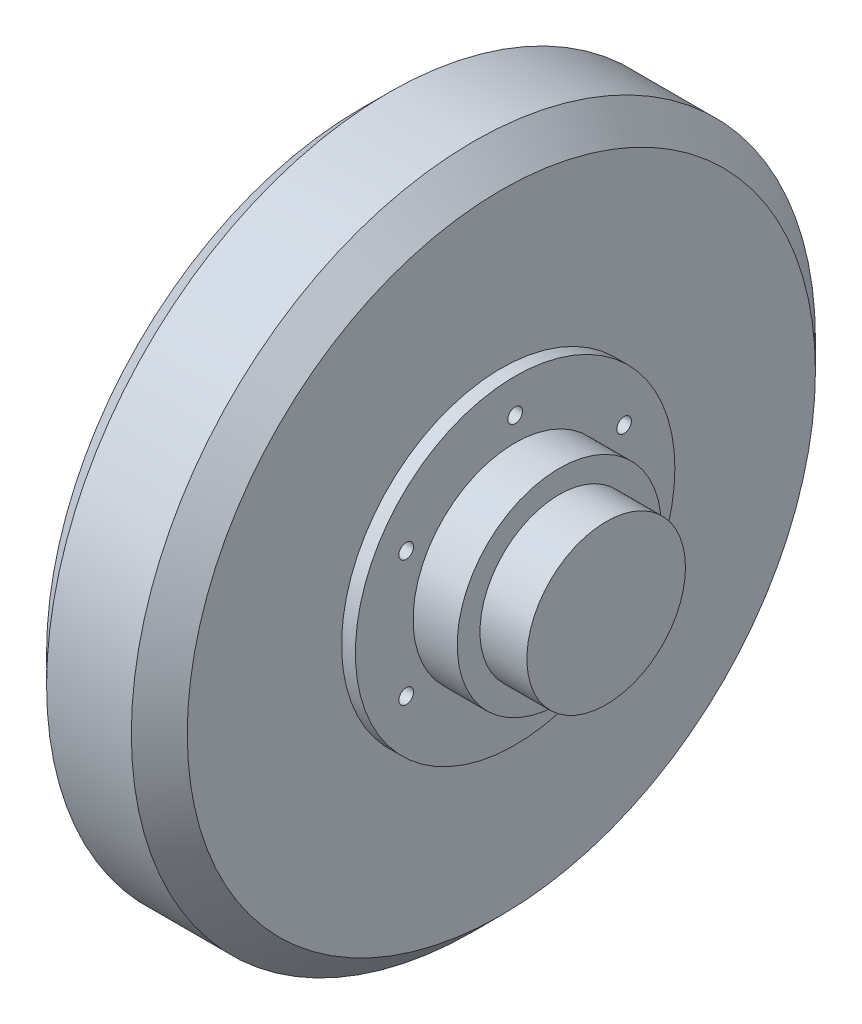
from build123d import *

# Parameters (mm, degrees)
SKETCH3_R          = 3.3734375
CUT_EXTRUDE1_DEPTH = 11.43
SKETCH5_R          = 3.3734375
CUT_EXTRUDE2_DEPTH = 12.7


with BuildPart() as part:
    # Sketch1 → Revolve1 (revolve)
    with BuildSketch(Plane(origin=(0, 0, 0), x_dir=(-1, 0, 0), z_dir=(0, 1, 0))):
        Polygon((6.35, 73.550123262), (0, 73.550123262), (0, 46.99), (-20.32, 46.99), (-20.32, 36.5125), (-41.91, 36.5125), (-41.91, 0), (90.17, 0), (90.17, 24.13), (83.82, 24.13), (83.82, 14.9987), (71.12, 14.9987), (71.12, 144.605660924), (58.245660924, 157.48), (19.224339076, 157.48), (6.35, 144.605660924), align=None)
    revolve(axis=Axis((0, 0, 0), (-1, 0, 0)))

    # Sketch3 → Cut-Extrude1 (cut)
    with BuildSketch(Plane(origin=(-71.12, 0, 0), x_dir=(0, -1, 0), z_dir=(-1, 0, 0))):
        with Locations((-22.394618112, 30.823547486)):
            Circle(SKETCH3_R)
        with Locations((22.394618112, 30.823547486)):
            Circle(SKETCH3_R)
        with Locations((36.235253271, -11.773547486)):
            Circle(SKETCH3_R)
        with Locations((0, -38.1)):
            Circle(SKETCH3_R)
        with Locations((-36.235253271, -11.773547486)):
            Circle(SKETCH3_R)
    extrude(amount=-CUT_EXTRUDE1_DEPTH, mode=Mode.SUBTRACT)

    # Sketch5 → Cut-Extrude2 (cut)
    with BuildSketch(Plane.YZ):
        with Locations((28.956, 50.153263184)):
            Circle(SKETCH5_R)
        with Locations((-28.956, 50.153263184)):
            Circle(SKETCH5_R)
        with Locations((-57.912, 0)):
            Circle(SKETCH5_R)
        with Locations((-28.956, -50.153263184)):
            Circle(SKETCH5_R)
        with Locations((28.956, -50.153263184)):
            Circle(SKETCH5_R)
        with Locations((57.912, 0)):
            Circle(SKETCH5_R)
    extrude(amount=-CUT_EXTRUDE2_DEPTH, mode=Mode.SUBTRACT)


solid = part.part
